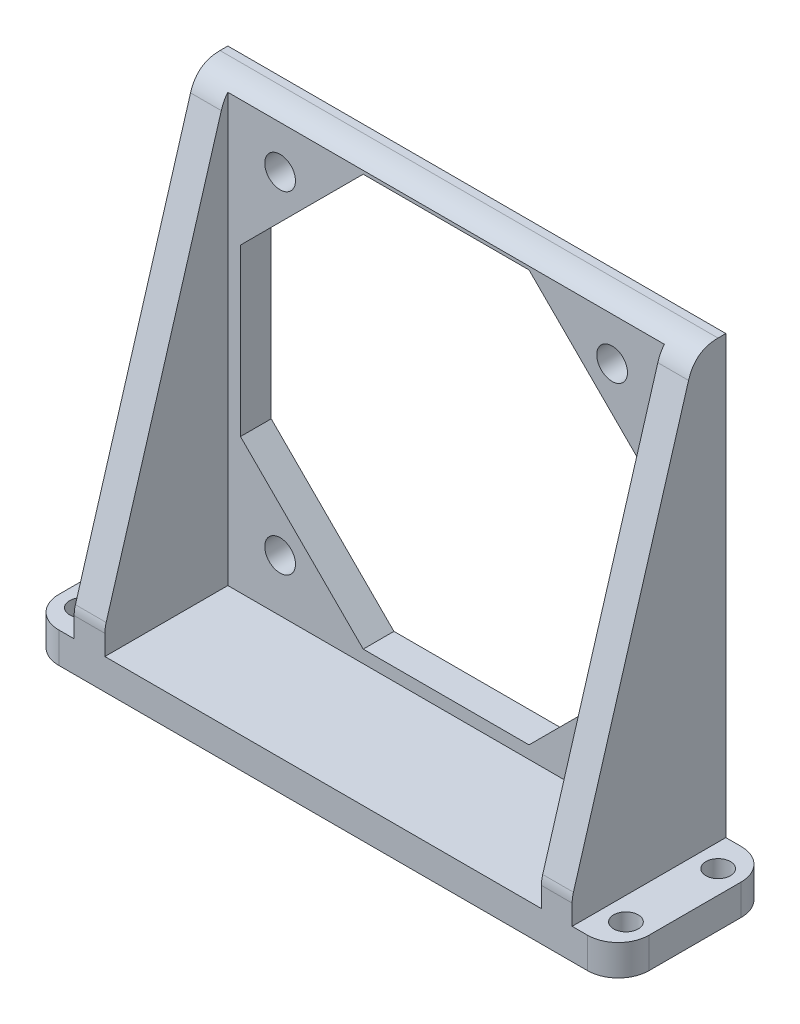
from build123d import *

# Parameters (mm, degrees)
SKETCH4_W                = 71
SKETCH4_H                = 71
SKETCH4_R                = 2.5
BOSS_EXTRUDE3_DEPTH      = 5
BOSS_EXTRUDE4_DEPTH      = 20
BOSS_EXTRUDE4_DEPTH_BACK = 5
CUT_EXTRUDE1_DEPTH       = 94.948123983
FILLET2_START            = -41
FILLET2_DEPTH            = 82
SKETCH8_W                = 7.5
SKETCH8_H                = 5
BOSS_EXTRUDE5_DEPTH      = 25
FILLET3_R                = 5
SKETCH10_R               = 2
SKETCH10_R_2             = 1.620466931
CUT_EXTRUDE2_DEPTH       = 25


with BuildPart() as part:
    # Sketch4 → Boss-Extrude3 (new body)
    with BuildSketch(Plane.XY):
        Rectangle(SKETCH4_W, SKETCH4_H)
        with Locations((-27, 27)):
            Circle(SKETCH4_R, mode=Mode.SUBTRACT)
        with Locations((27, 27)):
            Circle(SKETCH4_R, mode=Mode.SUBTRACT)
        with Locations((27, -27)):
            Circle(SKETCH4_R, mode=Mode.SUBTRACT)
        with Locations((-27, -27)):
            Circle(SKETCH4_R, mode=Mode.SUBTRACT)
        Polygon((-33.446601953, 13.48642712), (-13.48642712, 33.446601953), (13.48642712, 33.446601953), (33.446601953, 13.48642712), (33.446601953, -13.48642712), (13.48642712, -33.446601953), (-13.48642712, -33.446601953), (-33.446601953, -13.48642712), align=None, mode=Mode.SUBTRACT)
    extrude(amount=BOSS_EXTRUDE3_DEPTH)

    # Sketch5 → Boss-Extrude4 (add, two sides: drawn at the far end of the back side and taken through both)
    with BuildSketch(Plane.XY.offset(5).offset(-BOSS_EXTRUDE4_DEPTH_BACK)):
        Polygon((-35.5, 35.5), (-40.5, 35.5), (-40.5, -38.999937635), (-40.5, -40.5), (40.5, -40.5), (40.5, -38.999937635), (40.5, 35.5), (35.5, 35.5), (35.5, -35.5), (-35.5, -35.5), align=None)
    extrude(amount=BOSS_EXTRUDE4_DEPTH + BOSS_EXTRUDE4_DEPTH_BACK)

    # Sketch6 → Cut-Extrude1 (cut, through all)
    with BuildSketch(Plane.ZY.offset(40.5)):
        Polygon((5, 35.5), (25, 35.5), (25, -31.5), align=None)
    extrude(amount=-CUT_EXTRUDE1_DEPTH, mode=Mode.SUBTRACT)

    # Fillet2: read off the stored shape, not the designer's step
    # Fillet2 outline → Fillet2 (cut)
    with BuildSketch(Plane.YZ.offset(FILLET2_START)):
        with BuildLine():
            add(Edge.make_bspline(
                [(-30.800168474, 24.791095067), (-31.5, 25), (-32.230346106, 25)],
                knots=[0, 0, 0, 1, 1, 1], degree=2))
            Line((-30.800168474, 24.791095067), (-31.5, 25))
            Line((-31.5, 25), (-32.230346106, 25))
        make_face()
        with BuildLine():
            Line((35.5, 1.27452355), (35.5, 5))
            Line((35.5, 5), (31.930177632, 6.065618617))
            add(Edge.make_bspline(
                [(31.930177632, 6.065618617), (35.5, 5), (35.5, 1.27452355)],
                knots=[0.651540973, 0.651540973, 0.651540973, 1.651540973, 1.651540973, 1.651540973], degree=2))
        make_face()
    extrude(amount=FILLET2_DEPTH, mode=Mode.SUBTRACT)

    # Sketch8 → Boss-Extrude5 (add)
    with BuildSketch(Plane.XY.offset(25)):
        with Locations((-44.25, -38)):
            Rectangle(SKETCH8_W, SKETCH8_H)
        with Locations((44.25, -38)):
            Rectangle(SKETCH8_W, SKETCH8_H)
    extrude(amount=-BOSS_EXTRUDE5_DEPTH)

    # Fillet3
    fillet3_edges = [part.edges().sort_by_distance(p)[0] for p in [
        (-48, -38, 0),
        (-48, -38, 25),
        (48, -38, 0),
        (48, -38, 25),
    ]]
    fillet(fillet3_edges, radius=FILLET3_R)

    # Sketch10 → Cut-Extrude2 (cut)
    with BuildSketch(Plane(origin=(0, -35.5, 0), x_dir=(1, 0, 0), z_dir=(0, 1, 0))):
        with Locations(Location((44.25, -5, 0), (0, 0, 270))):
            Circle(SKETCH10_R)
        with Locations(Location((-44.25, -5, 0), (0, 0, 270))):
            Circle(SKETCH10_R_2)
        with Locations(Location((-44.25, -20, 0), (0, 0, 270))):
            Circle(SKETCH10_R)
        with Locations(Location((44.25, -20, 0), (0, 0, 270))):
            Circle(SKETCH10_R)
    extrude(amount=-CUT_EXTRUDE2_DEPTH, mode=Mode.SUBTRACT)


solid = part.part
